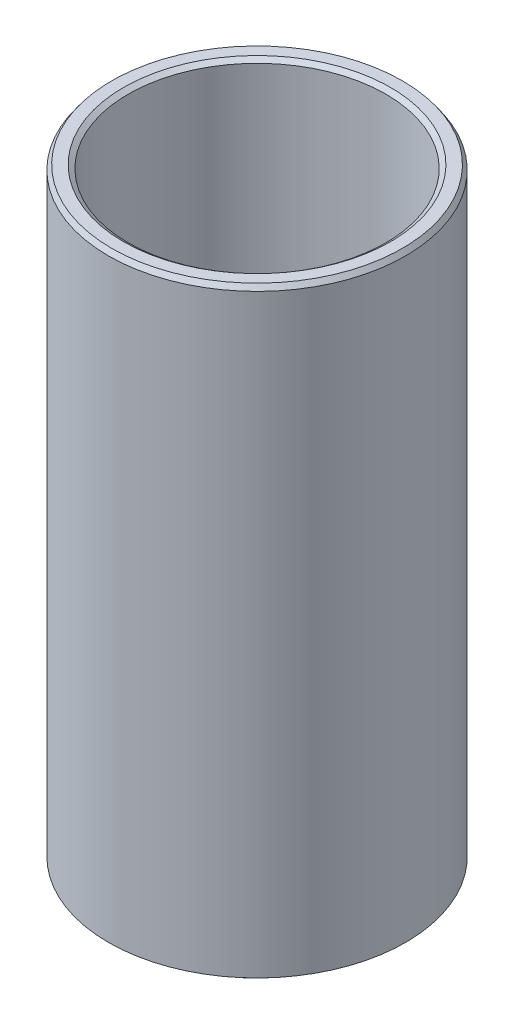
from build123d import *
from OCP.BRepFilletAPI import BRepFilletAPI_MakeChamfer

# Parameters (mm, degrees)
SKETCH1_R           = 50
BOSS_EXTRUDE1_DEPTH = 202.756444677
SKETCH2_R           = 43.335053059
CUT_EXTRUDE1_DEPTH  = 215.732801076
CHAMFER1_SIZE       = 1.600551176
CHAMFER1_SIZE2      = 1.137997752


with BuildPart() as part:
    # Sketch1 → Boss-Extrude1 (new body)
    with BuildSketch(Plane(origin=(0, 0, 0), x_dir=(1, 0, 0), z_dir=(0, 1, 0))):
        Circle(SKETCH1_R)
    extrude(amount=BOSS_EXTRUDE1_DEPTH)

    # Sketch2 → Cut-Extrude1 (cut, through all)
    with BuildSketch(Plane(origin=(0, 0, 0), x_dir=(1, 0, 0), z_dir=(0, 1, 0))):
        Circle(SKETCH2_R)
    extrude(amount=CUT_EXTRUDE1_DEPTH, mode=Mode.SUBTRACT)

    # Chamfer1: one chamfer whose edges measure the first distance from different faces: ONE call of the kernel's chamfer builder (chamfer() names one face for all edges)
    chamfer1_edges_1 = [part.edges().sort_by_distance(p)[0] for p in [
        (-43.335053059, 202.756444677, 0),
    ]]
    chamfer1_side_1 = [part.faces().sort_by_distance(p)[0] for p in [
        (-48.585786438, 202.756444677, 0),
    ]]
    chamfer1_edges_2 = [part.edges().sort_by_distance(p)[0] for p in [
        (-43.335053059, 0, 0),
    ]]
    chamfer1_side_2 = [part.faces().sort_by_distance(p)[0] for p in [
        (-43.335053059, 101.378222338, 0),
    ]]
    chamfer1_edges_3 = [part.edges().sort_by_distance(p)[0] for p in [
        (-50, 0, 0),
    ]]
    chamfer1_side_3 = [part.faces().sort_by_distance(p)[0] for p in [
        (-48.585786438, 0, 0),
    ]]
    chamfer1_edges_4 = [part.edges().sort_by_distance(p)[0] for p in [
        (-50, 202.756444677, 0),
    ]]
    chamfer1_side_4 = [part.faces().sort_by_distance(p)[0] for p in [
        (-50, 101.378222338, 0),
    ]]
    chamfer1 = BRepFilletAPI_MakeChamfer(part.part.solid().wrapped)
    for e in chamfer1_edges_1:
        chamfer1.Add(CHAMFER1_SIZE, CHAMFER1_SIZE2, e.wrapped, chamfer1_side_1[0].wrapped)  # the first distance lies on this face
    for e in chamfer1_edges_2:
        chamfer1.Add(CHAMFER1_SIZE, CHAMFER1_SIZE2, e.wrapped, chamfer1_side_2[0].wrapped)  # the first distance lies on this face
    for e in chamfer1_edges_3:
        chamfer1.Add(CHAMFER1_SIZE, CHAMFER1_SIZE2, e.wrapped, chamfer1_side_3[0].wrapped)  # the first distance lies on this face
    for e in chamfer1_edges_4:
        chamfer1.Add(CHAMFER1_SIZE, CHAMFER1_SIZE2, e.wrapped, chamfer1_side_4[0].wrapped)  # the first distance lies on this face
    add(Compound.cast(chamfer1.Shape()), mode=Mode.REPLACE)


solid = part.part
